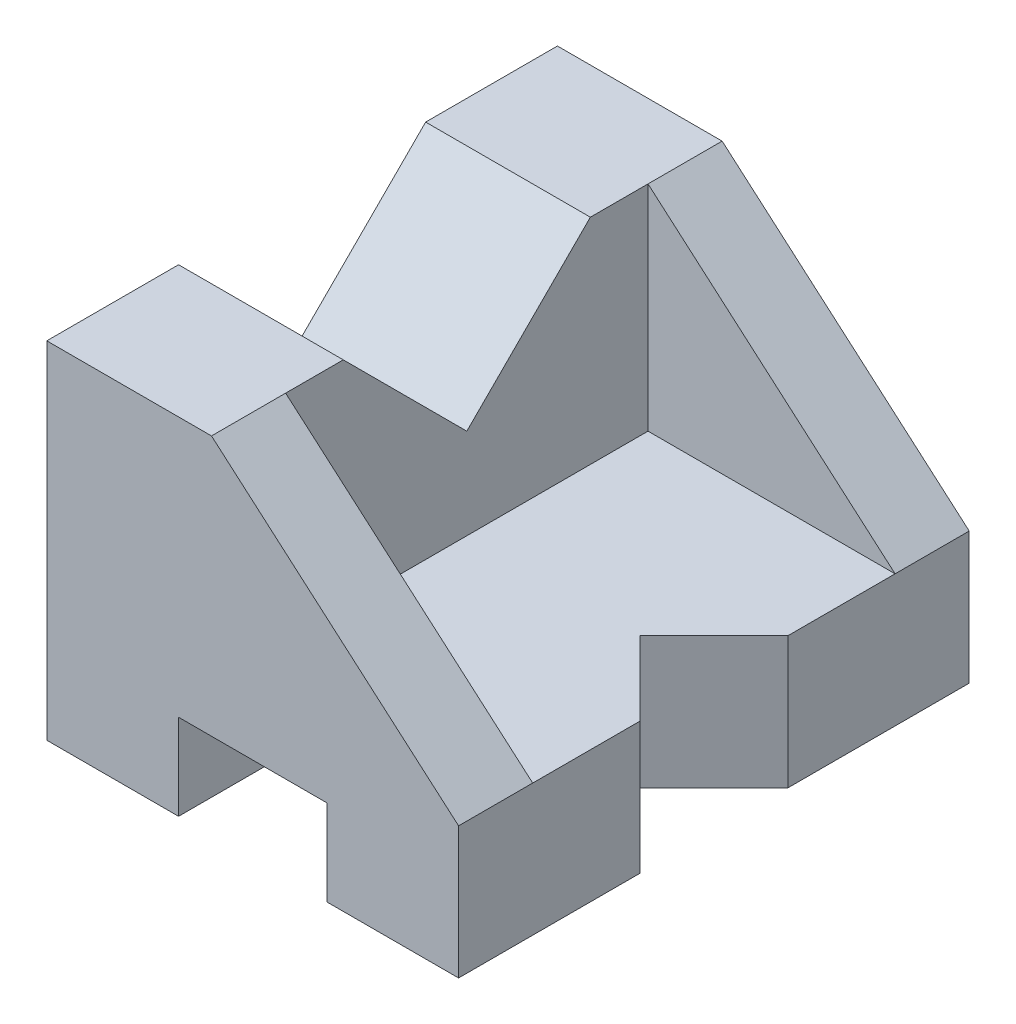
from build123d import *

# Parameters (mm, degrees)
BOSS_EXTRUDE4_DEPTH = 31
BOSS_EXTRUDE5_START = 22
BOSS_EXTRUDE5_DEPTH = 9
BOSS_EXTRUDE6_START = -22
BOSS_EXTRUDE6_DEPTH = 9
CUT_EXTRUDE1_REACH  = 62.208
CUT_EXTRUDE2_REACH  = 66.32


with BuildPart() as part:
    # Sketch1 → Boss-Extrude4 (new, symmetric)
    with BuildSketch(Plane.XY):
        Polygon((0, 42), (0, 0), (16, 0), (16, 10.421052632), (34, 10.421052632), (34, 0), (50, 0), (50, 16), (20, 16), (20, 42), align=None)
    extrude(amount=BOSS_EXTRUDE4_DEPTH, both=True)

    # Sketch1<7> → Boss-Extrude5 (add)
    with BuildSketch(Plane.XY.offset(BOSS_EXTRUDE5_START)):
        Polygon((50, 16), (20, 42), (20, 16), align=None)
    extrude(amount=BOSS_EXTRUDE5_DEPTH)

    # Sketch1<10> → Boss-Extrude6 (add)
    with BuildSketch(Plane.XY.offset(BOSS_EXTRUDE6_START)):
        Polygon((50, 16), (20, 42), (20, 16), align=None)
    extrude(amount=-BOSS_EXTRUDE6_DEPTH)

    # Sketch3 → Cut-Extrude1 (cut, up to next)
    with BuildSketch(Plane(origin=(20, 0, 0), x_dir=(0, 0, -1), z_dir=(1, 0, 0)), mode=Mode.PRIVATE) as cut_extrude1_sk1:
        Polygon((0, 27), (15, 42), (-15, 42), align=None)
    cut_extrude1_tool1 = extrude(cut_extrude1_sk1.sketch, amount=-CUT_EXTRUDE1_REACH, mode=Mode.PRIVATE) & part.part
    add(cut_extrude1_tool1.solids().sort_by_distance((20, 37, 0))[0], mode=Mode.SUBTRACT)

    # Sketch4 → Cut-Extrude2 (cut, up to next)
    with BuildSketch(Plane(origin=(0, 16, 0), x_dir=(1, 0, 0), z_dir=(0, 1, 0)), mode=Mode.PRIVATE) as cut_extrude2_sk1:
        Polygon((41, 1.265e-06), (50, -9), (50, 9), align=None)
    cut_extrude2_tool1 = extrude(cut_extrude2_sk1.sketch, amount=-CUT_EXTRUDE2_REACH, mode=Mode.PRIVATE) & part.part
    add(cut_extrude2_tool1.solids().sort_by_distance((47, 16, 0))[0], mode=Mode.SUBTRACT)


solid = part.part
